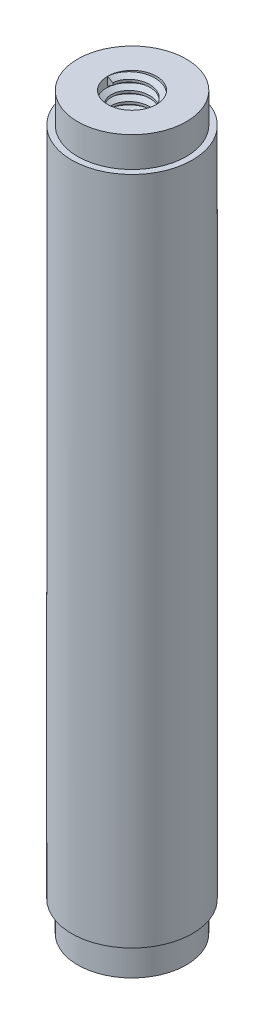
from build123d import *
from build123d.topology import SkipClean

# Parameters (mm, degrees)
SKETCH1_R           = 5
BOSS_EXTRUDE1_DEPTH = 60.5
SKETCH5_R           = 2.025
CUT_EXTRUDE1_DEPTH  = 19.05
THREAD1_PITCH       = 0.79375
CUT_EXTRUDE2_START  = -19.05
SKETCH19_R          = 2.025
CUT_EXTRUDE2_DEPTH  = 19.05
THREAD2_PITCH       = 0.79375
SKETCH24_R          = 5
SKETCH24_R_2        = 4.5
CUT_EXTRUDE3_DEPTH  = 2.5
CUT_EXTRUDE4_START  = -2.5
SKETCH25_R          = 5
SKETCH25_R_2        = 4.5
CUT_EXTRUDE4_DEPTH  = 2.5


with BuildPart() as part:
    # Sketch1 → Boss-Extrude1 (new body)
    with BuildSketch(Plane(origin=(0, 0, 0), x_dir=(1, 0, 0), z_dir=(0, 1, 0))):
        with Locations(Location((0, 0, 0), (0, 0, 270))):
            Circle(SKETCH1_R)
    extrude(amount=BOSS_EXTRUDE1_DEPTH)

    # Sketch5 → Cut-Extrude1 (cut)
    with BuildSketch(Plane.XZ):
        with Locations(Location((0, 0, 0), (0, 0, 270))):
            Circle(SKETCH5_R)
    extrude(amount=-CUT_EXTRUDE1_DEPTH, mode=Mode.SUBTRACT)

    # Thread1: the profile of Thread Profile3 profile screwed along a right-hand helix of 24 turns, 8 arcs to a turn; built about Z, then put on its axis
    thread1_z = Axis((0, 0, 0), (0, 0, 1))
    thread1_corners = [(2.0253, 0, -0.000173205), (2.0253, 0, 0.694704453), (1.595370212, 0, 0.446484374), (1.595370212, 0, 0.248046874)]
    with BuildLine(mode=Mode.PRIVATE) as thread1_profile:
        Line(thread1_corners[0], thread1_corners[1])
        Line(thread1_corners[1], thread1_corners[2])
        Line(thread1_corners[2], thread1_corners[3])
        Line(thread1_corners[3], thread1_corners[0])
    thread1_cap = Face(thread1_profile.wire())
    thread1_turn_angles = [0, 22.5, 45, 67.5, 90, 112.5, 135, 157.5, 180, 202.5, 225, 247.5, 270, 292.5, 315, 337.5, 360]
    thread1_turn_weights = [1, 0.9238795325112867, 1, 0.9238795325112867, 1, 0.9238795325112867, 1, 0.9238795325112867, 1, 0.9238795325112867, 1, 0.9238795325112867, 1, 0.9238795325112867, 1, 0.9238795325112867, 1]
    thread1_turn_rails = [Edge.make_bspline([Vector(p[0], p[1], 0).rotate(thread1_z, thread1_turn_angles[k]) / thread1_turn_weights[k] + Vector(0, 0, p[2] + THREAD1_PITCH * thread1_turn_angles[k] / 360) for k in range(17)], [0, 0, 0, 1, 1, 2, 2, 3, 3, 4, 4, 5, 5, 6, 6, 7, 7, 8, 8, 8], 2, thread1_turn_weights) for p in thread1_corners]
    thread1_turn_sides = [Face.make_surface_from_curves(thread1_turn_rails[p[0]], thread1_turn_rails[p[1]]) for p in [(0, 1), (1, 2), (2, 3), (3, 0)]]
    thread1 = Plane(origin=(0, 0, 0), x_dir=(1, 0, 0), z_dir=(0, 1, 0)) * Solid(Shell([*[p.moved(Location((0, 0, THREAD1_PITCH * i))) for i in range(24) for p in thread1_turn_sides], thread1_cap, thread1_cap.rotate(thread1_z, 8640).moved(Location((0, 0, THREAD1_PITCH * 8640 / 360)))]))
    add(thread1)

    # Sketch19 → Cut-Extrude2 (cut)
    with BuildSketch(Plane(origin=(0, 60.5, 0), x_dir=(1, 0, 0), z_dir=(0, 1, 0)).offset(CUT_EXTRUDE2_START)):
        with Locations(Location((0, 0, 0), (0, 0, 270))):
            Circle(SKETCH19_R)
    extrude(amount=CUT_EXTRUDE2_DEPTH, mode=Mode.SUBTRACT)

    # Thread2: the profile of Thread Profile4 profile screwed along a right-hand helix of 24 turns, 8 arcs to a turn; built about Z, then put on its axis
    thread2_z = Axis((0, 0, 0), (0, 0, 1))
    thread2_corners = [(2.0253, 0, -0.000173205), (2.0253, 0, 0.694704453), (1.595370212, 0, 0.446484374), (1.595370212, 0, 0.248046874)]
    with BuildLine(mode=Mode.PRIVATE) as thread2_profile:
        Line(thread2_corners[0], thread2_corners[1])
        Line(thread2_corners[1], thread2_corners[2])
        Line(thread2_corners[2], thread2_corners[3])
        Line(thread2_corners[3], thread2_corners[0])
    thread2_cap = Face(thread2_profile.wire())
    thread2_turn_angles = [0, 22.5, 45, 67.5, 90, 112.5, 135, 157.5, 180, 202.5, 225, 247.5, 270, 292.5, 315, 337.5, 360]
    thread2_turn_weights = [1, 0.9238795325112867, 1, 0.9238795325112867, 1, 0.9238795325112867, 1, 0.9238795325112867, 1, 0.9238795325112867, 1, 0.9238795325112867, 1, 0.9238795325112867, 1, 0.9238795325112867, 1]
    thread2_turn_rails = [Edge.make_bspline([Vector(p[0], p[1], 0).rotate(thread2_z, thread2_turn_angles[k]) / thread2_turn_weights[k] + Vector(0, 0, p[2] + THREAD2_PITCH * thread2_turn_angles[k] / 360) for k in range(17)], [0, 0, 0, 1, 1, 2, 2, 3, 3, 4, 4, 5, 5, 6, 6, 7, 7, 8, 8, 8], 2, thread2_turn_weights) for p in thread2_corners]
    thread2_turn_sides = [Face.make_surface_from_curves(thread2_turn_rails[p[0]], thread2_turn_rails[p[1]]) for p in [(0, 1), (1, 2), (2, 3), (3, 0)]]
    thread2 = Plane(origin=(0, 60.5, 0), x_dir=(-1, 0, 0), z_dir=(0, -1, 0)) * Solid(Shell([*[p.moved(Location((0, 0, THREAD2_PITCH * i))) for i in range(24) for p in thread2_turn_sides], thread2_cap, thread2_cap.rotate(thread2_z, 8640).moved(Location((0, 0, THREAD2_PITCH * 8640 / 360)))]))
    add(thread2)

    # Sketch24 → Cut-Extrude3 (cut)
    with SkipClean():  # the faces are left unmerged after this step: merging them gives an invalid solid
        with BuildSketch(Plane(origin=(0, 0, 0), x_dir=(-1, 0, 0), z_dir=(0, -1, 0))):
            with Locations(Location((0, 0, 0), (0, 0, 90))):
                Circle(SKETCH24_R)
            with Locations(Location((0, 0, 0), (0, 0, 90))):
                Circle(SKETCH24_R_2, mode=Mode.SUBTRACT)
        extrude(amount=-CUT_EXTRUDE3_DEPTH, mode=Mode.SUBTRACT)

    # Sketch25 → Cut-Extrude4 (cut)
    with SkipClean():  # the faces are left unmerged after this step: merging them gives an invalid solid
        with BuildSketch(Plane(origin=(0, 60.5, 0), x_dir=(1, 0, 0), z_dir=(0, 1, 0)).offset(CUT_EXTRUDE4_START)):
            with Locations(Location((0, 0, 0), (0, 0, 90))):
                Circle(SKETCH25_R)
            with Locations(Location((0, 0, 0), (0, 0, 90))):
                Circle(SKETCH25_R_2, mode=Mode.SUBTRACT)
        extrude(amount=CUT_EXTRUDE4_DEPTH, mode=Mode.SUBTRACT)


solid = part.part
